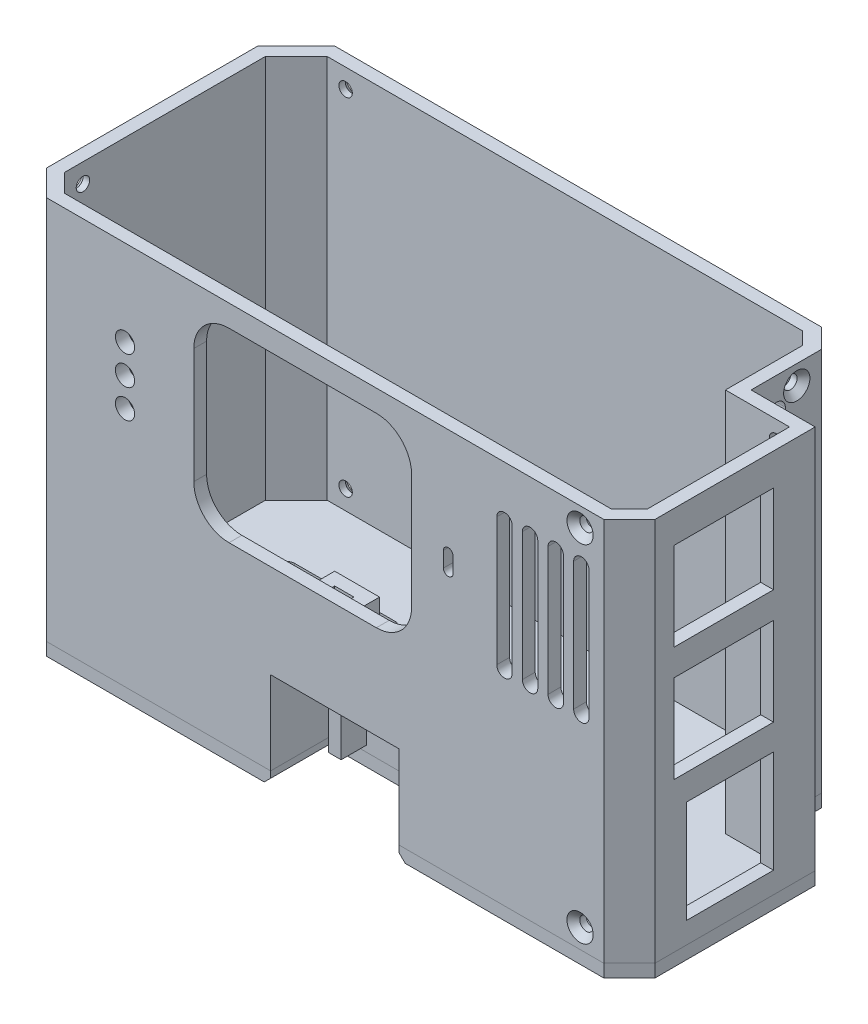
from build123d import *

# Parameters (mm, degrees)
SKETCH_1_W           = 95
SKETCH_1_H           = 62
EXTRUDE_1_DEPTH      = 43
CUT_EXTRUDE_3_REACH  = 131.719
SKETCH_4_W           = 10
SKETCH_4_H           = 14
CHAMFER_2_SIZE       = 6
CHAMFER_3_SIZE       = 4
SKETCH_7_W           = 20
SKETCH_7_H           = 20
CUT_EXTRUDE_5_DEPTH  = 10
SHELL_3_T            = -2
SKETCH_9_W           = 20
SKETCH_9_H           = 8
CUT_EXTRUDE_6_DEPTH  = 10
SKETCH_10_W          = 20
SKETCH_10_H          = 2
EXTRUDE_2_DEPTH      = 5
SKETCH_11_W          = 34
SKETCH_11_H          = 29
CUT_EXTRUDE_7_DEPTH  = 2
FILLET_5_R           = 5.5
SKETCH_12_W          = 14
SKETCH_12_H          = 19
EXTRUDE_3_DEPTH      = 4
SKETCH_13_W          = 10
SKETCH_13_H          = 4.57524596
CUT_EXTRUDE_8_DEPTH  = 17
SKETCH_14_W          = 10
SKETCH_14_H          = 19
CUT_EXTRUDE_9_DEPTH  = 4
CHAMFER_4_SIZE       = 1
SKETCH_15_W          = 13.55
SKETCH_15_H          = 16
SKETCH_15_W_2        = 15.5
SKETCH_15_H_2        = 13.76
CUT_EXTRUDE_10_DEPTH = 2
CUT_EXTRUDE_11_DEPTH = 2
SKETCH_17_W          = 9.5
SKETCH_17_H          = 3.5
SKETCH_17_W_2        = 6.6
SKETCH_17_H_2        = 3.222886834
SKETCH_17_H_3        = 3.335283253
SKETCH_17_W_3        = 7
SKETCH_17_H_4        = 4.033222468
SKETCH_17_W_4        = 7.58
SKETCH_17_H_5        = 2.8
SKETCH_17_W_5        = 10.642604823
SKETCH_17_H_6        = 1.8
CUT_EXTRUDE_12_DEPTH = 2
CHAMFER_9_SIZE       = 1
FILLET_2_R           = 1.2
FILLET_3_R           = 0.5
CHAMFER_7_SIZE       = 1
SKETCH_18_R          = 1.5
CUT_EXTRUDE_13_DEPTH = 2
SKETCH_20_W          = 6.5
SKETCH_20_H          = 3.033222468
EXTRUDE_4_DEPTH      = 1
SKETCH_21_W          = 4
SKETCH_21_H          = 3.033222468
EXTRUDE_5_DEPTH      = 1
FILLET_4_R           = 0.5
CHAMFER_10_SIZE      = 2
CHAMFER_11_SIZE      = 3
CUT_EXTRUDE_15_REACH = 103.799
CUT_EXTRUDE_18_REACH = 112.286
SKETCH_29_R          = 1.05
SKETCH_29_R_2        = 1.202143211
CUT_EXTRUDE_19_REACH = 121.465
SKETCH_30_R          = 1.05
CUT_EXTRUDE_20_REACH = 103.799
SKETCH_31_R          = 1.05
CUT_EXTRUDE_21_REACH = 117.169
SKETCH_32_R          = 1.05
CUT_EXTRUDE_22_REACH = 121.465
SKETCH_33_R          = 1.05
CHAMFER_20_SIZE      = 1
CUT_EXTRUDE_26_REACH = 121.465


# Read off the part's stored shape, not the designer's step: 分割1
with BuildPart() as part:
    # 草图1 → 凸台-拉伸1 (new body)
    with BuildSketch(Plane.XY):
        with Locations((-58.017381047, 4.902672836)):
            Rectangle(SKETCH_1_W, SKETCH_1_H)
    extrude(amount=EXTRUDE_1_DEPTH)

    # 草图4 → 切除-拉伸3 (cut, up to next)
    with BuildSketch(Plane.XZ.offset(26.097327164), mode=Mode.PRIVATE) as cut_extrude_3_sk1:
        with Locations((-15.517381047, 7)):
            Rectangle(SKETCH_4_W, SKETCH_4_H)
    cut_extrude_3_tool1 = extrude(cut_extrude_3_sk1.sketch, amount=-CUT_EXTRUDE_3_REACH, mode=Mode.PRIVATE) & part.part
    add(cut_extrude_3_tool1.solids().sort_by_distance((-15.517381, -26.097327, 7))[0], mode=Mode.SUBTRACT)

    # 倒角2
    chamfer_2_edges = [part.edges().sort_by_distance(p)[0] for p in [
        (-105.517381047, 4.902672836, 0),
    ]]
    chamfer(chamfer_2_edges, length=CHAMFER_2_SIZE)

    # 倒角3
    chamfer_3_edges = [part.edges().sort_by_distance(p)[0] for p in [
        (-10.517381047, 4.902672836, 43),
        (-105.517381047, 4.902672836, 43),
    ]]
    chamfer(chamfer_3_edges, length=CHAMFER_3_SIZE)

    # 草图7 → 切除-拉伸5 (cut)
    with BuildSketch(Plane.XY.offset(43)):
        with Locations((-56.517381047, -16.097327164)):
            Rectangle(SKETCH_7_W, SKETCH_7_H)
    extrude(amount=-CUT_EXTRUDE_5_DEPTH, mode=Mode.SUBTRACT)

    # 抽壳3
    shell_3_openings = [part.faces().sort_by_distance(p)[0] for p in [
        (-59.329321728, 35.902672836, 22.026293361),
    ]]
    offset(amount=SHELL_3_T, openings=shell_3_openings, kind=Kind.INTERSECTION)

    # 草图9 → 切除-拉伸6 (cut)
    with BuildSketch(Plane.XZ.offset(6.097327164)):
        with Locations((-56.517381047, 37)):
            Rectangle(SKETCH_9_W, SKETCH_9_H)
    extrude(amount=-CUT_EXTRUDE_6_DEPTH, mode=Mode.SUBTRACT)

    # 草图10 → 凸台-拉伸2 (add)
    with BuildSketch(Plane.XZ.offset(6.097327164)):
        with Locations((-56.517381047, 42)):
            Rectangle(SKETCH_10_W, SKETCH_10_H)
    extrude(amount=EXTRUDE_2_DEPTH)

    # 草图11 → 切除-拉伸7 (cut)
    with BuildSketch(Plane.XY.offset(43)):
        with Locations((-61.517381047, 18.002672836)):
            Rectangle(SKETCH_11_W, SKETCH_11_H)
    extrude(amount=-CUT_EXTRUDE_7_DEPTH, mode=Mode.SUBTRACT)

    # 圆角5
    fillet_5_edges = [part.edges().sort_by_distance(p)[0] for p in [
        (-44.517381047, 32.502672836, 42),
        (-44.517381047, 3.502672836, 42),
        (-78.517381047, 3.502672836, 42),
        (-78.517381047, 32.502672836, 42),
    ]]
    fillet(fillet_5_edges, radius=FILLET_5_R)

    # 草图12 → 凸台-拉伸3 (add)
    with BuildSketch(Plane.XY.offset(33)):
        with Locations((-56.517381047, -13.597327164)):
            Rectangle(SKETCH_12_W, SKETCH_12_H)
    extrude(amount=EXTRUDE_3_DEPTH)

    # 草图13 → 切除-拉伸8 (cut)
    with BuildSketch(Plane(origin=(0, -4.097327164, 0), x_dir=(1, 0, 0), z_dir=(0, 1, 0))):
        with Locations((-56.517381047, -33.28762298)):
            Rectangle(SKETCH_13_W, SKETCH_13_H)
    extrude(amount=-CUT_EXTRUDE_8_DEPTH, mode=Mode.SUBTRACT)

    # 草图14 → 切除-拉伸9 (cut)
    with BuildSketch(Plane.XY.offset(37)):
        with Locations((-56.517381047, -13.597327164)):
            Rectangle(SKETCH_14_W, SKETCH_14_H)
    extrude(amount=-CUT_EXTRUDE_9_DEPTH, mode=Mode.SUBTRACT)

    # 倒角4
    chamfer_4_edges = [part.edges().sort_by_distance(p)[0] for p in [
        (-46.517381047, -26.097327164, 38),
        (-66.517381047, -26.097327164, 38),
    ]]
    chamfer(chamfer_4_edges, length=CHAMFER_4_SIZE)

    # 草图15 → 切除-拉伸10 (cut)
    with BuildSketch(Plane(origin=(-10.517381047, 0, 0), x_dir=(0, 0, -1), z_dir=(1, 0, 0))):
        with Locations((-27.275, -12.777327164)):
            Rectangle(SKETCH_15_W, SKETCH_15_H)
        with Locations((-28.25, 6.122672836)):
            Rectangle(SKETCH_15_W_2, SKETCH_15_H_2)
        with Locations((-28.25, 24.022672836)):
            Rectangle(SKETCH_15_W_2, SKETCH_15_H_2)
    extrude(amount=-CUT_EXTRUDE_10_DEPTH, mode=Mode.SUBTRACT)

    # 草图16 → 切除-拉伸11 (cut)
    with BuildSketch(Plane.XY.offset(43)):
        with BuildLine():
            Line((-38.044404675, 19.202672836), (-38.044404675, 16.802672836))
            ThreePointArc((-38.044404675, 16.802672836), (-38.797381047, 16.049696464), (-39.55035742, 16.802672836))
            Line((-39.55035742, 16.802672836), (-39.55035742, 19.202672836))
            ThreePointArc((-39.55035742, 19.202672836), (-38.797381047, 19.955649209), (-38.044404675, 19.202672836))
        make_face()
    extrude(amount=-CUT_EXTRUDE_11_DEPTH, mode=Mode.SUBTRACT)

    # 草图17 → 切除-拉伸12 (cut)
    with BuildSketch(Plane.XZ.offset(26.097327164)):
        with Locations((-89.167381047, 14.816992129)):
            Rectangle(SKETCH_17_W, SKETCH_17_H)
        with Locations((-89.167381047, 22.061353331)):
            Rectangle(SKETCH_17_W, SKETCH_17_H)
        with Locations((-74.844770146, 21.922796748)):
            Rectangle(SKETCH_17_W_2, SKETCH_17_H_2)
        with Locations((-61.344770146, 21.978994958)):
            Rectangle(SKETCH_17_W_2, SKETCH_17_H_3)
        with Locations((-79.926338187, 15.083603363)):
            Rectangle(SKETCH_17_W_3, SKETCH_17_H_4)
        with Locations((-71.476338187, 15.083603363)):
            Rectangle(SKETCH_17_W_3, SKETCH_17_H_4)
        with Locations((-47.727381047, 15.166992129)):
            Rectangle(SKETCH_17_W_4, SKETCH_17_H_5)
        with Locations((-58.244603889, 15.666992129)):
            Rectangle(SKETCH_17_W_5, SKETCH_17_H_6)
    extrude(amount=-CUT_EXTRUDE_12_DEPTH, mode=Mode.SUBTRACT)

    # 倒角9
    chamfer_9_edges = [part.edges().sort_by_distance(p)[0] for p in [
        (-64.644770146, -24.097327164, 21.978994958),
        (-61.344770146, -24.097327164, 23.646636584),
        (-58.044770146, -24.097327164, 21.978994958),
        (-61.344770146, -24.097327164, 20.311353331),
        (-78.144770146, -24.097327164, 21.922796748),
        (-74.844770146, -24.097327164, 23.534240165),
        (-71.544770146, -24.097327164, 21.922796748),
        (-74.844770146, -24.097327164, 20.311353331),
        (-51.517381047, -24.097327164, 15.166992129),
        (-47.727381047, -24.097327164, 16.566992129),
        (-43.937381047, -24.097327164, 15.166992129),
        (-47.727381047, -24.097327164, 13.766992129),
    ]]
    chamfer(chamfer_9_edges, length=CHAMFER_9_SIZE)

    # 圆角2
    fillet_2_edges = [part.edges().sort_by_distance(p)[0] for p in [
        (-93.917381047, -25.097327164, 20.311353331),
        (-93.917381047, -25.097327164, 23.811353331),
        (-84.417381047, -25.097327164, 23.811353331),
        (-84.417381047, -25.097327164, 20.311353331),
        (-93.917381047, -25.097327164, 13.066992129),
        (-93.917381047, -25.097327164, 16.566992129),
        (-84.417381047, -25.097327164, 16.566992129),
        (-84.417381047, -25.097327164, 13.066992129),
    ]]
    fillet(fillet_2_edges, radius=FILLET_2_R)

    # 圆角3
    fillet_3_edges = [part.edges().sort_by_distance(p)[0] for p in [
        (-63.5659063, -25.097327164, 14.766992129),
        (-63.5659063, -25.097327164, 16.566992129),
        (-52.923301477, -25.097327164, 16.566992129),
        (-52.923301477, -25.097327164, 14.766992129),
        (-74.976338187, -25.097327164, 13.066992129),
        (-74.976338187, -25.097327164, 17.100214597),
        (-67.976338187, -25.097327164, 17.100214597),
        (-67.976338187, -25.097327164, 13.066992129),
        (-83.426338187, -25.097327164, 13.066992129),
        (-83.426338187, -25.097327164, 17.100214597),
        (-76.426338187, -25.097327164, 17.100214597),
        (-76.426338187, -25.097327164, 13.066992129),
        (-51.517381047, -25.597327164, 13.766992129),
        (-43.937381047, -25.597327164, 13.766992129),
        (-78.144770146, -25.597327164, 23.534240165),
        (-71.544770146, -25.597327164, 23.534240165),
        (-64.644770146, -25.597327164, 23.646636584),
        (-58.044770146, -25.597327164, 23.646636584),
    ]]
    fillet(fillet_3_edges, radius=FILLET_3_R)

    # 倒角7
    chamfer_7_edges = [part.edges().sort_by_distance(p)[0] for p in [
        (-51.517381047, -25.597327164, 16.566992129),
        (-43.937381047, -25.597327164, 16.566992129),
        (-78.144770146, -25.597327164, 20.311353331),
        (-71.544770146, -25.597327164, 20.311353331),
        (-64.644770146, -25.597327164, 20.311353331),
        (-58.044770146, -25.597327164, 20.311353331),
    ]]
    chamfer(chamfer_7_edges, length=CHAMFER_7_SIZE)

    # 草图18 → 切除-拉伸13 (cut)
    with BuildSketch(Plane.XY.offset(43)):
        with Locations((-89.256052289, 13.504339551)):
            Circle(SKETCH_18_R)
        with Locations((-89.256052289, 18.004339551)):
            Circle(SKETCH_18_R)
        with Locations((-89.256052289, 22.504339551)):
            Circle(SKETCH_18_R)
    extrude(amount=-CUT_EXTRUDE_13_DEPTH, mode=Mode.SUBTRACT)

    # 草图20 → 凸台-拉伸4 (add)
    with BuildSketch(Plane(origin=(0, -24.097327164, 0), x_dir=(1, 0, 0), z_dir=(0, 1, 0))):
        with Locations((-80.176338187, -15.083603363)):
            Rectangle(SKETCH_20_W, SKETCH_20_H)
        with Locations((-71.726338187, -15.083603363)):
            Rectangle(SKETCH_20_W, SKETCH_20_H)
    extrude(amount=-EXTRUDE_4_DEPTH)

    # 草图21 → 凸台-拉伸5 (add)
    with BuildSketch(Plane.XZ.offset(25.097327164)):
        with Locations((-78.926338187, 15.083603363)):
            Rectangle(SKETCH_21_W, SKETCH_21_H)
        with Locations((-70.476338187, 15.083603363)):
            Rectangle(SKETCH_21_W, SKETCH_21_H)
    extrude(amount=EXTRUDE_5_DEPTH)

    # 圆角4
    fillet_4_edges = [part.edges().sort_by_distance(p)[0] for p in [
        (-83.426338187, -25.097327164, 15.083603363),
        (-76.926338187, -25.097327164, 13.566992129),
        (-76.926338187, -25.097327164, 16.600214597),
        (-74.976338187, -25.097327164, 15.083603363),
        (-68.476338187, -25.097327164, 13.566992129),
        (-68.476338187, -25.097327164, 16.600214597),
        (-80.926338187, -25.597327164, 13.566992129),
        (-80.926338187, -25.597327164, 16.600214597),
        (-72.476338187, -25.597327164, 13.566992129),
        (-72.476338187, -25.597327164, 16.600214597),
    ]]
    fillet(fillet_4_edges, radius=FILLET_4_R)

    # 倒角10
    chamfer_10_edges = [part.edges().sort_by_distance(p)[0] for p in [
        (-22.517381047, 5.902672836, 2),
    ]]
    chamfer(chamfer_10_edges, length=CHAMFER_10_SIZE)

    # 倒角11
    chamfer_11_edges = [part.edges().sort_by_distance(p)[0] for p in [
        (-20.517381047, 4.902672836, 0),
    ]]
    chamfer(chamfer_11_edges, length=CHAMFER_11_SIZE)

    # 草图26 → 切除-拉伸15 (cut, up to next)
    with BuildSketch(Plane(origin=(-20.517381047, 0, 0), x_dir=(0, 0, -1), z_dir=(1, 0, 0)), mode=Mode.PRIVATE) as cut_extrude_15_sk1:
        with BuildLine():
            Line((-8.656644619, 30.902672836), (-8.656644619, -21.097327164))
            ThreePointArc((-8.656644619, -21.097327164), (-10, -22.440682545), (-11.343355381, -21.097327164))
            Line((-11.343355381, -21.097327164), (-11.343355381, 30.902672836))
            ThreePointArc((-11.343355381, 30.902672836), (-10, 32.246028218), (-8.656644619, 30.902672836))
        make_face()
    cut_extrude_15_tool1 = extrude(cut_extrude_15_sk1.sketch, amount=-CUT_EXTRUDE_15_REACH, mode=Mode.PRIVATE) & part.part
    add(cut_extrude_15_tool1.solids().sort_by_distance((-20.517381, 4.902673, 10))[0], mode=Mode.SUBTRACT)

    # 草图29 → 切除-拉伸18 (cut, up to next)
    with BuildSketch(Plane.ZY.offset(105.517381047), mode=Mode.PRIVATE) as cut_extrude_18_sk1:
        with Locations(Location((35.301724394, 32.902672836, 0), (0, 0, 270))):
            Circle(SKETCH_29_R)
    cut_extrude_18_tool1 = extrude(cut_extrude_18_sk1.sketch, amount=-CUT_EXTRUDE_18_REACH, mode=Mode.PRIVATE) & part.part
    # 草图29 → 切除-拉伸18 (cut, up to next)
    with BuildSketch(Plane.ZY.offset(105.517381047), mode=Mode.PRIVATE) as cut_extrude_18_sk2:
        with Locations(Location((35.301724394, -21.097327164, 0), (0, 0, 270))):
            Circle(SKETCH_29_R_2)
    cut_extrude_18_tool2 = extrude(cut_extrude_18_sk2.sketch, amount=-CUT_EXTRUDE_18_REACH, mode=Mode.PRIVATE) & part.part
    add(cut_extrude_18_tool1.solids().sort_by_distance((-105.517381, 32.902673, 35.301724))[0], mode=Mode.SUBTRACT)
    add(cut_extrude_18_tool2.solids().sort_by_distance((-105.517381, -21.097327, 35.301724))[0], mode=Mode.SUBTRACT)

    # 草图30 → 切除-拉伸19 (cut, up to next)
    with BuildSketch(Plane(origin=(0, 0, 0), x_dir=(-1, 0, 0), z_dir=(0, 0, -1)), mode=Mode.PRIVATE) as cut_extrude_19_sk1:
        with Locations((95.819105442, 32.902672836)):
            Circle(SKETCH_30_R)
    cut_extrude_19_tool1 = extrude(cut_extrude_19_sk1.sketch, amount=-CUT_EXTRUDE_19_REACH, mode=Mode.PRIVATE) & part.part
    # 草图30 → 切除-拉伸19 (cut, up to next)
    with BuildSketch(Plane(origin=(0, 0, 0), x_dir=(-1, 0, 0), z_dir=(0, 0, -1)), mode=Mode.PRIVATE) as cut_extrude_19_sk2:
        with Locations((95.819105442, -21.097327164)):
            Circle(SKETCH_30_R)
    cut_extrude_19_tool2 = extrude(cut_extrude_19_sk2.sketch, amount=-CUT_EXTRUDE_19_REACH, mode=Mode.PRIVATE) & part.part
    add(cut_extrude_19_tool1.solids().sort_by_distance((-95.819105, 32.902673, 0))[0], mode=Mode.SUBTRACT)
    add(cut_extrude_19_tool2.solids().sort_by_distance((-95.819105, -21.097327, 0))[0], mode=Mode.SUBTRACT)

    # 草图31 → 切除-拉伸20 (cut, up to next)
    with BuildSketch(Plane(origin=(-20.517381047, 0, 0), x_dir=(0, 0, -1), z_dir=(1, 0, 0)), mode=Mode.PRIVATE) as cut_extrude_20_sk1:
        with Locations((-6.869848481, 32.902672836)):
            Circle(SKETCH_31_R)
    cut_extrude_20_tool1 = extrude(cut_extrude_20_sk1.sketch, amount=-CUT_EXTRUDE_20_REACH, mode=Mode.PRIVATE) & part.part
    # 草图31 → 切除-拉伸20 (cut, up to next)
    with BuildSketch(Plane(origin=(-20.517381047, 0, 0), x_dir=(0, 0, -1), z_dir=(1, 0, 0)), mode=Mode.PRIVATE) as cut_extrude_20_sk2:
        with Locations((-6.869848481, -21.097327164)):
            Circle(SKETCH_31_R)
    cut_extrude_20_tool2 = extrude(cut_extrude_20_sk2.sketch, amount=-CUT_EXTRUDE_20_REACH, mode=Mode.PRIVATE) & part.part
    add(cut_extrude_20_tool1.solids().sort_by_distance((-20.517381, 32.902673, 6.869848))[0], mode=Mode.SUBTRACT)
    add(cut_extrude_20_tool2.solids().sort_by_distance((-20.517381, -21.097327, 6.869848))[0], mode=Mode.SUBTRACT)

    # 草图32 → 切除-拉伸21 (cut, up to next)
    with BuildSketch(Plane(origin=(0, 0, 14), x_dir=(-1, 0, 0), z_dir=(0, 0, -1)), mode=Mode.PRIVATE) as cut_extrude_21_sk1:
        with Locations((14.617381047, 32.902672836)):
            Circle(SKETCH_32_R)
    cut_extrude_21_tool1 = extrude(cut_extrude_21_sk1.sketch, amount=-CUT_EXTRUDE_21_REACH, mode=Mode.PRIVATE) & part.part
    # 草图32 → 切除-拉伸21 (cut, up to next)
    with BuildSketch(Plane(origin=(0, 0, 14), x_dir=(-1, 0, 0), z_dir=(0, 0, -1)), mode=Mode.PRIVATE) as cut_extrude_21_sk2:
        with Locations((14.617381047, -21.097327164)):
            Circle(SKETCH_32_R)
    cut_extrude_21_tool2 = extrude(cut_extrude_21_sk2.sketch, amount=-CUT_EXTRUDE_21_REACH, mode=Mode.PRIVATE) & part.part
    add(cut_extrude_21_tool1.solids().sort_by_distance((-14.617381, 32.902673, 14))[0], mode=Mode.SUBTRACT)
    add(cut_extrude_21_tool2.solids().sort_by_distance((-14.617381, -21.097327, 14))[0], mode=Mode.SUBTRACT)

    # 草图33 → 切除-拉伸22 (cut, up to next)
    with BuildSketch(Plane.XY.offset(43), mode=Mode.PRIVATE) as cut_extrude_22_sk1:
        with Locations((-18.215656653, 32.902672836)):
            Circle(SKETCH_33_R)
    cut_extrude_22_tool1 = extrude(cut_extrude_22_sk1.sketch, amount=-CUT_EXTRUDE_22_REACH, mode=Mode.PRIVATE) & part.part
    # 草图33 → 切除-拉伸22 (cut, up to next)
    with BuildSketch(Plane.XY.offset(43), mode=Mode.PRIVATE) as cut_extrude_22_sk2:
        with Locations((-18.215656653, -21.097327164)):
            Circle(SKETCH_33_R)
    cut_extrude_22_tool2 = extrude(cut_extrude_22_sk2.sketch, amount=-CUT_EXTRUDE_22_REACH, mode=Mode.PRIVATE) & part.part
    add(cut_extrude_22_tool1.solids().sort_by_distance((-18.215657, 32.902673, 43))[0], mode=Mode.SUBTRACT)
    add(cut_extrude_22_tool2.solids().sort_by_distance((-18.215657, -21.097327, 43))[0], mode=Mode.SUBTRACT)

    # 倒角20
    # the kernel refuses this chamfer: 1 mm, written as the material it takes off along each edge
    with BuildSketch(Plane(origin=(-105.517381047, 32.902672836, 35.301724394), x_dir=(0, -1, 0), z_dir=(0, 0, -1))) as chamfer_20_piece_1:
        Polygon((1.05 + CHAMFER_20_SIZE, 0), (1.05, -CHAMFER_20_SIZE), (1.05, 0), align=None)
    revolve(axis=Axis((-105.517381047, 32.902672836, 35.301724394), (-1, 0, 0)), mode=Mode.SUBTRACT)
    with BuildSketch(Plane(origin=(-105.517381047, -21.097327164, 35.301724394), x_dir=(0, -1, 0), z_dir=(0, 0, -1))) as chamfer_20_piece_2:
        Polygon((1.202143211 + CHAMFER_20_SIZE, 0), (1.202143211, -CHAMFER_20_SIZE), (1.202143211, 0), align=None)
    revolve(axis=Axis((-105.517381047, -21.097327164, 35.301724394), (-1, 0, 0)), mode=Mode.SUBTRACT)
    with BuildSketch(Plane(origin=(-95.819105442, 32.902672836, 0), x_dir=(-1, 0, 0), z_dir=(0, -1, 0))) as chamfer_20_piece_3:
        Polygon((1.05 + CHAMFER_20_SIZE, 0), (1.05, -CHAMFER_20_SIZE), (1.05, 0), align=None)
    revolve(axis=Axis((-95.819105442, 32.902672836, 0), (0, 0, -1)), mode=Mode.SUBTRACT)
    with BuildSketch(Plane(origin=(-95.819105442, -21.097327164, 0), x_dir=(-1, 0, 0), z_dir=(0, -1, 0))) as chamfer_20_piece_4:
        Polygon((1.05 + CHAMFER_20_SIZE, 0), (1.05, -CHAMFER_20_SIZE), (1.05, 0), align=None)
    revolve(axis=Axis((-95.819105442, -21.097327164, 0), (0, 0, -1)), mode=Mode.SUBTRACT)
    with BuildSketch(Plane(origin=(-20.517381047, 32.902672836, 6.869848481), x_dir=(0, 0, -1), z_dir=(0, -1, 0))) as chamfer_20_piece_5:
        Polygon((1.05 + CHAMFER_20_SIZE, 0), (1.05, -CHAMFER_20_SIZE), (1.05, 0), align=None)
    revolve(axis=Axis((-20.517381047, 32.902672836, 6.869848481), (1, 0, 0)), mode=Mode.SUBTRACT)
    with BuildSketch(Plane(origin=(-20.517381047, -21.097327164, 6.869848481), x_dir=(0, 0, -1), z_dir=(0, -1, 0))) as chamfer_20_piece_6:
        Polygon((1.05 + CHAMFER_20_SIZE, 0), (1.05, -CHAMFER_20_SIZE), (1.05, 0), align=None)
    revolve(axis=Axis((-20.517381047, -21.097327164, 6.869848481), (1, 0, 0)), mode=Mode.SUBTRACT)
    with BuildSketch(Plane(origin=(-14.617381047, 32.902672836, 14), x_dir=(-1, 0, 0), z_dir=(0, -1, 0))) as chamfer_20_piece_7:
        Polygon((1.05 + CHAMFER_20_SIZE, 0), (1.05, -CHAMFER_20_SIZE), (1.05, 0), align=None)
    revolve(axis=Axis((-14.617381047, 32.902672836, 14), (0, 0, -1)), mode=Mode.SUBTRACT)
    with BuildSketch(Plane(origin=(-14.617381047, -21.097327164, 14), x_dir=(-1, 0, 0), z_dir=(0, -1, 0))) as chamfer_20_piece_8:
        Polygon((1.05 + CHAMFER_20_SIZE, 0), (1.05, -CHAMFER_20_SIZE), (1.05, 0), align=None)
    revolve(axis=Axis((-14.617381047, -21.097327164, 14), (0, 0, -1)), mode=Mode.SUBTRACT)
    with BuildSketch(Plane(origin=(-18.215656653, 32.902672836, 43), x_dir=(1, 0, 0), z_dir=(0, -1, 0))) as chamfer_20_piece_9:
        Polygon((1.05 + CHAMFER_20_SIZE, 0), (1.05, -CHAMFER_20_SIZE), (1.05, 0), align=None)
    revolve(axis=Axis((-18.215656653, 32.902672836, 43), (0, 0, 1)), mode=Mode.SUBTRACT)
    with BuildSketch(Plane(origin=(-18.215656653, -21.097327164, 43), x_dir=(1, 0, 0), z_dir=(0, -1, 0))) as chamfer_20_piece_10:
        Polygon((1.05 + CHAMFER_20_SIZE, 0), (1.05, -CHAMFER_20_SIZE), (1.05, 0), align=None)
    revolve(axis=Axis((-18.215656653, -21.097327164, 43), (0, 0, 1)), mode=Mode.SUBTRACT)

    # 草图27 → 切除-拉伸26 (cut, up to next)
    with BuildSketch(Plane.XY.offset(43), mode=Mode.PRIVATE) as cut_extrude_26_sk1:
        with BuildLine():
            Line((-16.817381047, 27.902672836), (-16.817381047, 7.902672836))
            ThreePointArc((-16.817381047, 7.902672836), (-18.017381047, 6.702672836), (-19.217381047, 7.902672836))
            Line((-19.217381047, 7.902672836), (-19.217381047, 27.902672836))
            ThreePointArc((-19.217381047, 27.902672836), (-18.017381047, 29.102672836), (-16.817381047, 27.902672836))
        make_face()
    cut_extrude_26_tool1 = extrude(cut_extrude_26_sk1.sketch, amount=-CUT_EXTRUDE_26_REACH, mode=Mode.PRIVATE) & part.part
    # 草图27 → 切除-拉伸26 (cut, up to next)
    with BuildSketch(Plane.XY.offset(43), mode=Mode.PRIVATE) as cut_extrude_26_sk2:
        with BuildLine():
            Line((-20.817381047, 27.902672836), (-20.817381047, 7.902672836))
            ThreePointArc((-20.817381047, 7.902672836), (-22.017381047, 6.702672836), (-23.217381047, 7.902672836))
            Line((-23.217381047, 7.902672836), (-23.217381047, 27.902672836))
            ThreePointArc((-23.217381047, 27.902672836), (-22.017381047, 29.102672836), (-20.817381047, 27.902672836))
        make_face()
    cut_extrude_26_tool2 = extrude(cut_extrude_26_sk2.sketch, amount=-CUT_EXTRUDE_26_REACH, mode=Mode.PRIVATE) & part.part
    # 草图27 → 切除-拉伸26 (cut, up to next)
    with BuildSketch(Plane.XY.offset(43), mode=Mode.PRIVATE) as cut_extrude_26_sk3:
        with BuildLine():
            Line((-24.817381047, 27.902672836), (-24.817381047, 7.902672836))
            ThreePointArc((-24.817381047, 7.902672836), (-26.017381047, 6.702672836), (-27.217381047, 7.902672836))
            Line((-27.217381047, 7.902672836), (-27.217381047, 27.902672836))
            ThreePointArc((-27.217381047, 27.902672836), (-26.017381047, 29.102672836), (-24.817381047, 27.902672836))
        make_face()
    cut_extrude_26_tool3 = extrude(cut_extrude_26_sk3.sketch, amount=-CUT_EXTRUDE_26_REACH, mode=Mode.PRIVATE) & part.part
    # 草图27 → 切除-拉伸26 (cut, up to next)
    with BuildSketch(Plane.XY.offset(43), mode=Mode.PRIVATE) as cut_extrude_26_sk4:
        with BuildLine():
            Line((-28.817381047, 27.902672836), (-28.817381047, 7.902672836))
            ThreePointArc((-28.817381047, 7.902672836), (-30.017381047, 6.702672836), (-31.217381047, 7.902672836))
            Line((-31.217381047, 7.902672836), (-31.217381047, 27.902672836))
            ThreePointArc((-31.217381047, 27.902672836), (-30.017381047, 29.102672836), (-28.817381047, 27.902672836))
        make_face()
    cut_extrude_26_tool4 = extrude(cut_extrude_26_sk4.sketch, amount=-CUT_EXTRUDE_26_REACH, mode=Mode.PRIVATE) & part.part
    add(cut_extrude_26_tool1.solids().sort_by_distance((-18.017381, 17.902673, 43))[0], mode=Mode.SUBTRACT)
    add(cut_extrude_26_tool2.solids().sort_by_distance((-22.017381, 17.902673, 43))[0], mode=Mode.SUBTRACT)
    add(cut_extrude_26_tool3.solids().sort_by_distance((-26.017381, 17.902673, 43))[0], mode=Mode.SUBTRACT)
    add(cut_extrude_26_tool4.solids().sort_by_distance((-30.017381, 17.902673, 43))[0], mode=Mode.SUBTRACT)


with BuildPart() as body_2:
    # Split Bodies 1: the piece on the far side of the plane
    add(part.part)
    split(bisect_by=Plane(origin=(0, -24.097327164, 0), x_dir=(1, 0, 0), z_dir=(0, 1, 0)), keep=Keep.BOTTOM)


with BuildPart() as part_1:
    add(part.part)

    # Split Bodies 1
    split(bisect_by=Plane(origin=(0, -24.097327164, 0), x_dir=(1, 0, 0), z_dir=(0, 1, 0)), keep=Keep.TOP)


solid = Compound([body_2.part, part_1.part])
